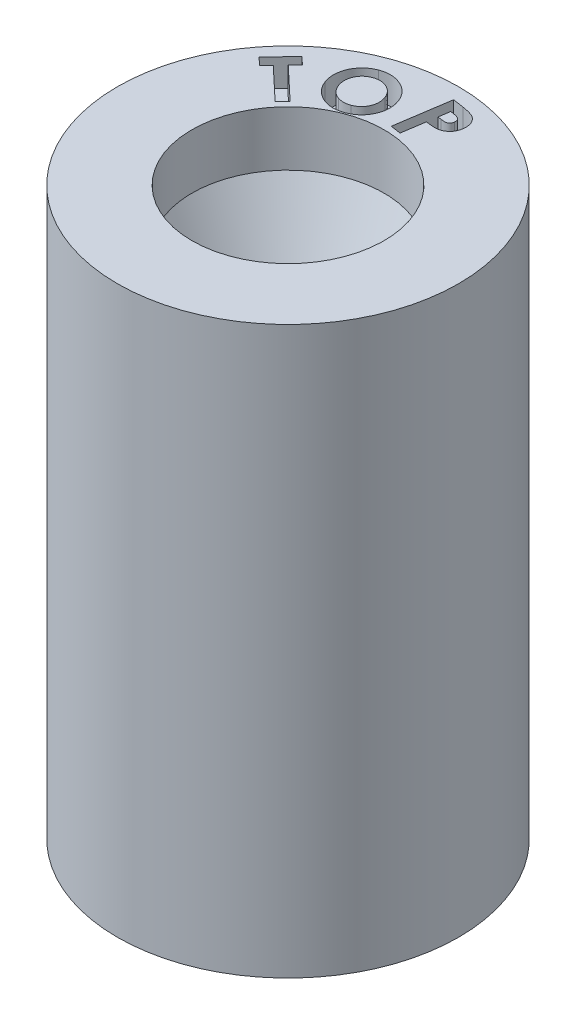
from build123d import *

# Parameters (mm, degrees)
CUT_EXTRUDE1_DEPTH = 1


with BuildPart() as part:
    # Sketch1 → Revolve1 (revolve)
    with BuildSketch(Plane.XY):
        Polygon((-6.212577979, 20.611326433), (-6.212577979, 0), (-3.628571429, 0), (-3.628571429, 1), (-3.855163947, 1), (-3.15, 2.937422021), (-3.15, 3.937422021), (-4.11313166, 5.982052584), (-3.25, 8.353487328), (-3.25, 9.353487328), (-4.190075978, 11.349173025), (-3.35, 13.657262806), (-3.35, 14.657262806), (-5.212577979, 18.611326433), (-3.5, 18.611326433), (-3.5, 20.611326433), (-5.212577979, 20.611326433), align=None)
    revolve(axis=Axis((0, 31.746947892, 0), (0, -1, 0)))

    # Sketch2 → Cut-Extrude1 (cut)
    # profile 1 of 3: a face of its own
    with BuildSketch(Plane(origin=(0, 20.611326433, 0), x_dir=(1, 0, 0), z_dir=(0, 1, 0))):
        Polygon((-4.56436006, 3.510865228), (-3.80634724, 4.314951767), (-3.53311006, 4.057339587), (-3.78311006, 3.792115228), (-2.601219035, 2.677932536), (-2.866042752, 2.397083177), (-4.047933778, 3.511265869), (-4.291122881, 3.253253049), align=None)
    # profile 2 of 3: a face of its own
    with BuildSketch(Plane(origin=(0, 20.611326433, 0), x_dir=(1, 0, 0), z_dir=(0, 1, 0))):
        with BuildLine():
            add(Edge.make_bspline(
                [(-1.984008183, 5.280361602), (-1.951361471, 5.291864674), (-1.88694019, 5.314563519), (-1.787725021, 5.336370562), (-1.68867447, 5.348141474), (-1.589745002, 5.349694056), (-1.490857629, 5.341460898), (-1.392298103, 5.321755045), (-1.293748326, 5.292309021), (-1.196403871, 5.253275434), (-1.102663259, 5.205794342), (-1.015015452, 5.150302329), (-0.935150045, 5.087039683), (-0.861966979, 5.017138314), (-0.796876373, 4.939342491), (-0.73936393, 4.854147851), (-0.688944448, 4.76185377), (-0.661954334, 4.696238913), (-0.648271004, 4.662973781)],
                knots=[0, 0, 0, 0, 1.014620015, 2.002134859, 2.972530124, 3.936379391, 4.899703057, 5.877754481, 6.8792585, 7.912999375, 8.950201094, 9.957656246, 10.950665226, 11.934255845, 12.921397626, 13.919955046, 14.945467956, 16, 16, 16, 16], degree=3))
            add(Edge.make_bspline(
                [(-0.648271004, 4.662973781), (-0.63638026, 4.629392518), (-0.61295524, 4.563236713), (-0.589851307, 4.46165008), (-0.577140328, 4.360875701), (-0.573405857, 4.260609673), (-0.581411296, 4.161006464), (-0.59900927, 4.061774462), (-0.627409696, 3.96337395), (-0.665193824, 3.866652344), (-0.711800808, 3.774099537), (-0.765344192, 3.687244444), (-0.827037032, 3.608656621), (-0.895274393, 3.53691719), (-0.970765267, 3.472755362), (-1.053447889, 3.415996435), (-1.143233673, 3.366624476), (-1.207147436, 3.340505611), (-1.239617158, 3.327236602)],
                knots=[0, 0, 0, 0, 1.050443095, 2.069395309, 3.066451062, 4.044188339, 5.024281049, 6.009012539, 7.013051648, 8.041151473, 9.068526114, 10.066795816, 11.046571626, 12.010893031, 12.98366294, 13.964080367, 14.965704093, 16, 16, 16, 16], degree=3))
            add(Edge.make_bspline(
                [(-1.239617158, 3.327236602), (-1.274127433, 3.315054091), (-1.341989406, 3.291098061), (-1.445869846, 3.267661601), (-1.548514012, 3.254707417), (-1.650189905, 3.251930751), (-1.75089728, 3.261090365), (-1.850633006, 3.280394266), (-1.94954384, 3.310198365), (-2.045954485, 3.350999293), (-2.138143697, 3.40040609), (-2.22443778, 3.456402546), (-2.302868686, 3.519734512), (-2.374265293, 3.589345467), (-2.438323962, 3.665754961), (-2.494446917, 3.749315409), (-2.543893935, 3.839140593), (-2.569840129, 3.903068192), (-2.582966517, 3.935409679)],
                knots=[0, 0, 0, 0, 1.068399082, 2.100929906, 3.103575799, 4.086993591, 5.066099282, 6.051588829, 7.050066646, 8.078224887, 9.104508757, 10.102185959, 11.078879156, 12.044476055, 13.01104188, 13.985980333, 14.981091238, 16, 16, 16, 16], degree=3))
            add(Edge.make_bspline(
                [(-2.582966517, 3.935409679), (-2.591031999, 3.957608631), (-2.607000287, 4.001558795), (-2.625194192, 4.068869717), (-2.639487416, 4.136112234), (-2.648403317, 4.203638954), (-2.653985128, 4.271173172), (-2.654136841, 4.339047901), (-2.650302733, 4.407189998), (-2.641385851, 4.475167924), (-2.628161649, 4.542316332), (-2.611012019, 4.608054044), (-2.589636953, 4.671990291), (-2.564429793, 4.734318929), (-2.534734181, 4.794775853), (-2.500865551, 4.853430446), (-2.463311476, 4.910534936), (-2.421107468, 4.965051951), (-2.376303157, 5.017463289), (-2.327995092, 5.066095425), (-2.276893667, 5.110880435), (-2.22391969, 5.152796947), (-2.16764059, 5.190081477), (-2.109138956, 5.224223048), (-2.047940788, 5.254887272), (-2.005373568, 5.271848436), (-1.984008183, 5.280361602)],
                knots=[0, 0, 0, 0, 1.038304274, 2.055666484, 3.063558632, 4.059469263, 5.049125639, 6.041722948, 7.04190207, 8.048681291, 9.054243446, 10.05001552, 11.034377102, 12.017055174, 13.004687854, 13.993978178, 14.9941573, 16.007936071, 17.024025995, 18.02491189, 19.019436086, 20.011042457, 20.993299201, 21.985531542, 22.98889582, 24, 24, 24, 24], degree=3))
        make_face()
        with BuildLine():
            add(Edge.make_bspline(
                [(-1.856604337, 4.93220455), (-1.877488693, 4.92365394), (-1.91851888, 4.906855091), (-1.976141706, 4.875154856), (-2.029352302, 4.839330962), (-2.07716166, 4.797778435), (-2.121273982, 4.752720461), (-2.159788123, 4.701995242), (-2.193935, 4.647031656), (-2.222951228, 4.587951901), (-2.246566945, 4.526332772), (-2.263599351, 4.462972911), (-2.273536668, 4.398614762), (-2.27710429, 4.333408334), (-2.274490192, 4.267185167), (-2.264020731, 4.200196791), (-2.247720257, 4.132036594), (-2.232009133, 4.087262923), (-2.223992158, 4.064416089)],
                knots=[0, 0, 0, 0, 1.027375829, 2.018421, 2.990439743, 3.944023084, 4.899254799, 5.858180169, 6.839107485, 7.843140547, 8.852193577, 9.840995123, 10.826271385, 11.813424366, 12.81213429, 13.839510119, 14.897558497, 16, 16, 16, 16], degree=3))
            add(Edge.make_bspline(
                [(-2.223992158, 4.064416089), (-2.213798406, 4.039614197), (-2.193848628, 3.99107542), (-2.156249795, 3.9236025), (-2.113828887, 3.862281189), (-2.06483441, 3.80861926), (-2.011373958, 3.760637802), (-1.951978549, 3.720171095), (-1.887377574, 3.685917894), (-1.841209626, 3.669112319), (-1.817742158, 3.660569935)],
                knots=[0, 0, 0, 0, 1.083525323, 2.1205235, 3.11684475, 4.091862613, 5.05205136, 6.015227223, 6.991127069, 8, 8, 8, 8], degree=3))
            add(Edge.make_bspline(
                [(-1.817742158, 3.660569935), (-1.799002821, 3.654754787), (-1.762043231, 3.643285572), (-1.70554032, 3.632132288), (-1.649226843, 3.626132067), (-1.592931479, 3.624909068), (-1.536766699, 3.628526479), (-1.480722939, 3.636985935), (-1.424739365, 3.650502694), (-1.388282452, 3.663569843), (-1.369825491, 3.67018532)],
                knots=[0, 0, 0, 0, 1.029425888, 2.030336445, 3.017427379, 3.999126242, 4.982625746, 5.96814704, 6.971338277, 8, 8, 8, 8], degree=3))
            add(Edge.make_bspline(
                [(-1.369825491, 3.67018532), (-1.34949883, 3.678648278), (-1.309356026, 3.695361643), (-1.252607106, 3.72624702), (-1.200635206, 3.762435253), (-1.1536402, 3.803801847), (-1.110222276, 3.849045135), (-1.072357905, 3.899958064), (-1.038326537, 3.955219174), (-1.009568703, 4.014754411), (-0.985903475, 4.076913057), (-0.968659856, 4.140392331), (-0.957596172, 4.204373501), (-0.953708077, 4.26897552), (-0.956140066, 4.334052485), (-0.964994469, 4.399684223), (-0.98069353, 4.465819319), (-0.995897927, 4.509116919), (-1.003639594, 4.531162884)],
                knots=[0, 0, 0, 0, 1.013702308, 2.001944841, 2.969505415, 3.924311064, 4.881590383, 5.852274522, 6.840804181, 7.866971879, 8.892918308, 9.900179829, 10.892243886, 11.878378268, 12.875578152, 13.887337569, 14.924289568, 16, 16, 16, 16], degree=3))
            add(Edge.make_bspline(
                [(-1.003639594, 4.531162884), (-1.012468698, 4.552705636), (-1.029822569, 4.595048566), (-1.062108693, 4.654687243), (-1.099238225, 4.70938077), (-1.140491725, 4.759881587), (-1.18698285, 4.805198641), (-1.237600405, 4.8464288), (-1.293177353, 4.882458178), (-1.352515379, 4.913455711), (-1.414191915, 4.938948321), (-1.476774937, 4.958423701), (-1.539771322, 4.970857515), (-1.602851173, 4.977036053), (-1.666265934, 4.976195963), (-1.729885687, 4.968423593), (-1.793815921, 4.954098386), (-1.835495575, 4.939565013), (-1.856604337, 4.93220455)],
                knots=[0, 0, 0, 0, 1.064468554, 2.092245113, 3.095323204, 4.084803289, 5.069746878, 6.060094084, 7.066589321, 8.094020857, 9.118469475, 10.115576809, 11.087225592, 12.050716488, 13.009917633, 13.982104002, 14.978031626, 16, 16, 16, 16], degree=3))
        make_face(mode=Mode.SUBTRACT)
    # profile 3 of 3: a face of its own
    with BuildSketch(Plane(origin=(0, 20.611326433, 0), x_dir=(1, 0, 0), z_dir=(0, 1, 0))):
        with BuildLine():
            Line((0.319736773, 5.710692831), (0.717973953, 5.650196036))
            add(Edge.make_bspline(
                [(0.717973953, 5.650196036), (0.743902764, 5.646045699), (0.79385866, 5.638049427), (0.865780479, 5.62449996), (0.931643136, 5.60974626), (0.991715408, 5.594210641), (1.045898892, 5.577459816), (1.094240077, 5.559654843), (1.136670613, 5.540774211), (1.173848076, 5.520942792), (1.206955458, 5.499340015), (1.236881443, 5.475614656), (1.264775614, 5.450221564), (1.290589117, 5.422843815), (1.31409698, 5.393403719), (1.335182561, 5.361714757), (1.353769797, 5.328091897), (1.370838485, 5.292955797), (1.38468134, 5.255853927), (1.396514214, 5.217547543), (1.404720683, 5.177810596), (1.410460986, 5.136863936), (1.413156153, 5.09468289), (1.413115497, 5.051197309), (1.410363143, 5.006494117), (1.406329806, 4.976431285), (1.40427203, 4.961093472)],
                knots=[0, 0, 0, 0, 1.688229069, 3.252636493, 4.704540505, 6.02698088, 7.240917417, 8.349367494, 9.337115164, 10.224530104, 11.055662565, 11.875002781, 12.6772488, 13.479035212, 14.291644414, 15.096550986, 15.923013501, 16.760243991, 17.605405922, 18.466468419, 19.335414512, 20.210911126, 21.123029556, 22.050337979, 23.005298238, 24, 24, 24, 24], degree=3))
            add(Edge.make_bspline(
                [(1.40427203, 4.961093472), (1.401452611, 4.944348909), (1.395905318, 4.911403473), (1.383409886, 4.863710013), (1.367785295, 4.818727833), (1.349196456, 4.776456135), (1.328174232, 4.736451732), (1.303107475, 4.699666501), (1.275416801, 4.66544148), (1.244866226, 4.634018364), (1.211574799, 4.605867226), (1.176559052, 4.579861392), (1.139377902, 4.557158291), (1.10011758, 4.537347969), (1.058888378, 4.520478872), (1.015399143, 4.506998629), (0.970042726, 4.496009093), (0.93890313, 4.491185373), (0.923102158, 4.488737702)],
                knots=[0, 0, 0, 0, 1.117210854, 2.198146215, 3.240619598, 4.248268683, 5.23534936, 6.210538489, 7.172886701, 8.13016332, 9.090260798, 10.039635115, 10.998444087, 11.953700707, 12.931461489, 13.926727378, 14.947972086, 16, 16, 16, 16], degree=3))
            add(Edge.make_bspline(
                [(0.923102158, 4.488737702), (0.912828624, 4.487648862), (0.890460584, 4.485278186), (0.853916812, 4.484985168), (0.811954758, 4.485628073), (0.764674185, 4.488737979), (0.71202169, 4.493025514), (0.653958459, 4.49970374), (0.590338811, 4.507515769), (0.546217946, 4.514138258), (0.523262414, 4.517583856)],
                knots=[0, 0, 0, 0, 0.616710196, 1.34273161, 2.180398292, 3.12326001, 4.17183664, 5.335424521, 6.613654912, 8, 8, 8, 8], degree=3))
            Line((0.523262414, 4.517583856), (0.397060491, 3.6830486))
            Line((0.397060491, 3.6830486), (0.02165985, 3.739939625))
            Line((0.02165985, 3.739939625), (0.319736773, 5.710692831))
        make_face()
        with BuildLine():
            Line((0.578550876, 4.883369113), (0.697541261, 4.865340267))
            add(Edge.make_bspline(
                [(0.697541261, 4.865340267), (0.719283364, 4.862320542), (0.759208035, 4.856775471), (0.814178481, 4.852168958), (0.858797826, 4.851278874), (0.894596253, 4.854446528), (0.924004036, 4.862575762), (0.949580582, 4.874229986), (0.973042156, 4.889233252), (0.993492173, 4.908318224), (1.011224982, 4.930599401), (1.024855738, 4.956520109), (1.035495896, 4.985047193), (1.039324821, 5.005484965), (1.041291261, 5.015981292)],
                knots=[0, 0, 0, 0, 1.833449879, 3.366734321, 4.605095567, 5.558652403, 6.35706345, 7.140923108, 7.899035707, 8.672747628, 9.467252148, 10.265896979, 11.109408165, 12, 12, 12, 12], degree=3))
            add(Edge.make_bspline(
                [(1.041291261, 5.015981292), (1.042461017, 5.02518096), (1.044744085, 5.043136378), (1.044159855, 5.069503184), (1.04112273, 5.094441696), (1.034614557, 5.117911802), (1.025058202, 5.13991631), (1.012300825, 5.160359449), (0.996701546, 5.17928194), (0.984290354, 5.190284042), (0.977989979, 5.195869113)],
                knots=[0, 0, 0, 0, 1.109819556, 2.16608632, 3.150579647, 4.113375299, 5.073640952, 6.015054913, 6.992369208, 8, 8, 8, 8], degree=3))
            add(Edge.make_bspline(
                [(0.977989979, 5.195869113), (0.972589347, 5.199851811), (0.96102598, 5.208379221), (0.940929924, 5.219577628), (0.916976272, 5.229099242), (0.89003484, 5.239716671), (0.858835497, 5.247851306), (0.824331679, 5.256518719), (0.786209983, 5.264039929), (0.759522579, 5.268213745), (0.745618184, 5.270388343)],
                knots=[0, 0, 0, 0, 0.653317591, 1.39882744, 2.232434306, 3.16275391, 4.217064049, 5.36873055, 6.62908322, 8, 8, 8, 8], degree=3))
            Line((0.745618184, 5.270388343), (0.639848953, 5.286413984))
            Line((0.639848953, 5.286413984), (0.578550876, 4.883369113))
        make_face(mode=Mode.SUBTRACT)
    extrude(amount=-CUT_EXTRUDE1_DEPTH, mode=Mode.SUBTRACT)


solid = part.part
